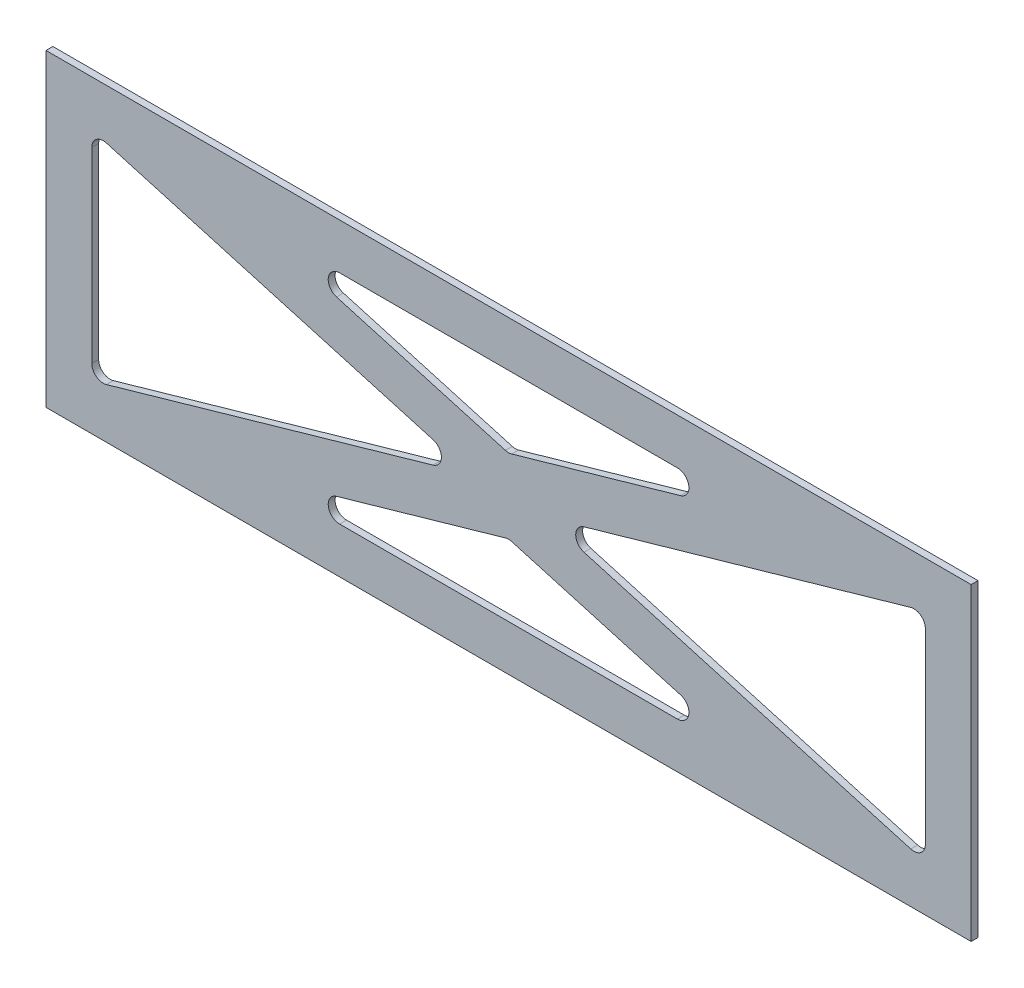
from build123d import *

# Parameters (mm, degrees)
SKETCH1_W           = 404
SKETCH1_H           = 135
BOSS_EXTRUDE1_DEPTH = 3


with BuildPart() as part:
    # Sketch1 → Boss-Extrude1 (new body)
    with BuildSketch(Plane.XY.offset(152)):
        with Locations((134.5, 0.5)):
            Rectangle(SKETCH1_W, SKETCH1_H)
        with BuildLine():
            Line((-47.5, -40.366714874), (-47.5, 41.366714874))
            ThreePointArc((-47.5, 41.366714874), (-45.509636043, 45.359469674), (-41.123163645, 46.173410377))
            Line((-41.123163645, 46.173410377), (101.547280659, 5.306695502))
            ThreePointArc((101.547280659, 5.306695502), (105.170444303, 0.5), (101.547280659, -4.306695502))
            Line((101.547280659, -4.306695502), (-41.123163645, -45.173410377))
            ThreePointArc((-41.123163645, -45.173410377), (-45.509636043, -44.359469674), (-47.5, -40.366714874))
        make_face(mode=Mode.SUBTRACT)
        with BuildLine():
            Line((208.256578831, 48), (60.743421169, 48))
            ThreePointArc((60.743421169, 48), (55.79198312, 43.695169939), (59.366584814, 38.193304498))
            Line((59.366584814, 38.193304498), (133.123163644, 17.066370381))
            ThreePointArc((133.123163644, 17.066370381), (134.5, 16.873065883), (135.876836355, 17.066370381))
            Line((135.876836355, 17.066370381), (209.633415186, 38.193304498))
            ThreePointArc((209.633415186, 38.193304498), (213.20801688, 43.695169939), (208.256578831, 48))
        make_face(mode=Mode.SUBTRACT)
        with BuildLine():
            Line((310.123163644, 46.173410377), (167.452719341, 5.306695502))
            ThreePointArc((167.452719341, 5.306695502), (163.829555697, 0.5), (167.452719341, -4.306695502))
            Line((167.452719341, -4.306695502), (310.123163644, -45.173410377))
            ThreePointArc((310.123163644, -45.173410377), (314.509636043, -44.359469674), (316.5, -40.366714874))
            Line((316.5, -40.366714874), (316.5, 41.366714874))
            ThreePointArc((316.5, 41.366714874), (314.509636043, 45.359469674), (310.123163644, 46.173410377))
        make_face(mode=Mode.SUBTRACT)
        with BuildLine():
            Line((59.366584814, -37.193304498), (133.123163644, -16.066370381))
            ThreePointArc((133.123163644, -16.066370381), (134.5, -15.873065883), (135.876836355, -16.066370381))
            Line((135.876836355, -16.066370381), (209.633415186, -37.193304498))
            ThreePointArc((209.633415186, -37.193304498), (213.20801688, -42.695169939), (208.256578831, -47))
            Line((208.256578831, -47), (60.743421169, -47))
            ThreePointArc((60.743421169, -47), (55.79198312, -42.695169939), (59.366584814, -37.193304498))
        make_face(mode=Mode.SUBTRACT)
    extrude(amount=BOSS_EXTRUDE1_DEPTH)


solid = part.part
